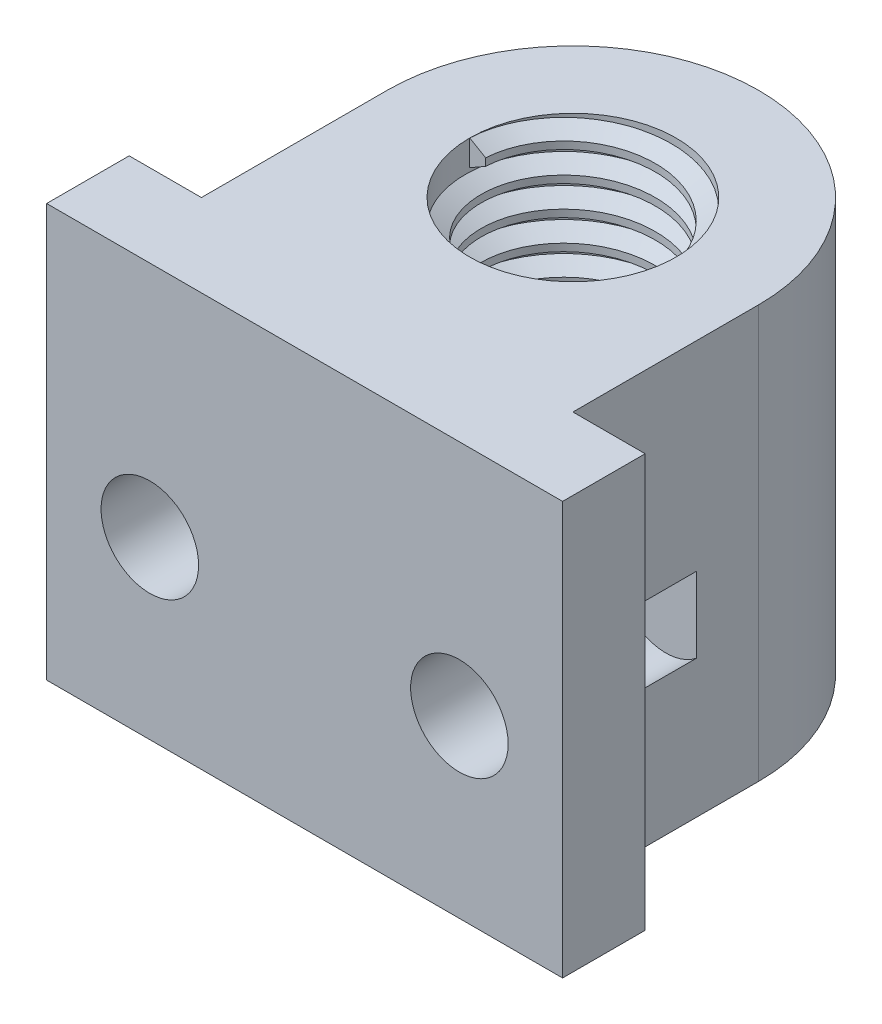
from build123d import *

# Parameters (mm, degrees)
SKETCH1_R           = 5.715
SKETCH1_R_2         = 3.175
SKETCH1_W           = 15.875
SKETCH1_H           = 2.54
BOSS_EXTRUDE1_DEPTH = 12.7
THREAD1_PITCH       = 0.907142857
THREAD1_TO          = 12.7
SKETCH3_R           = 1.5
CUT_EXTRUDE1_DEPTH  = 6.35


with BuildPart() as part:
    # Sketch1 → Boss-Extrude1 (new body)
    # profile 1 of 4: a face of its own
    with BuildSketch(Plane(origin=(0, 0, 0), x_dir=(1, 0, 0), z_dir=(0, 1, 0))):
        Circle(SKETCH1_R)
        with Locations(Location((0, 0, 0), (0, 0, 270))):
            Circle(SKETCH1_R_2, mode=Mode.SUBTRACT)
    # profile 2 of 4: a face of its own
    with BuildSketch(Plane(origin=(0, 0, 0), x_dir=(1, 0, 0), z_dir=(0, 1, 0))):
        with BuildLine():
            Line((-5.715, 0), (-5.715, -5.715))
            Line((-5.715, -5.715), (0, -5.715))
            ThreePointArc((0, -5.715), (-4.041115254, -4.041115254), (-5.715, 0))
        make_face()
    # profile 3 of 4: a face of its own
    with BuildSketch(Plane(origin=(0, 0, 0), x_dir=(1, 0, 0), z_dir=(0, 1, 0))):
        with BuildLine():
            ThreePointArc((5.715, 0), (4.041115254, -4.041115254), (0, -5.715))
            Line((0, -5.715), (5.715, -5.715))
            Line((5.715, -5.715), (5.715, 0))
        make_face()
    # profile 4 of 4: a face of its own
    with BuildSketch(Plane(origin=(0, 0, 0), x_dir=(1, 0, 0), z_dir=(0, 1, 0))):
        with Locations((0, -6.985)):
            Rectangle(SKETCH1_W, SKETCH1_H)
    extrude(amount=BOSS_EXTRUDE1_DEPTH)

    # Thread1: arcs per turn and ends read off the stored shape
    # Thread1: the profile of Thread Profile1 profile screwed along a right-hand helix through 14 turns, 8 arcs to a turn; built about Z, then put on its axis
    thread1_z = Axis((0, 0, 0), (0, 0, 1))
    thread1_corners = [(3.1753, 0, -0.000173205), (3.1753, 0, 0.793923203), (2.683994528, 0, 0.510267856), (2.683994528, 0, 0.283482142)]
    with BuildLine(mode=Mode.PRIVATE) as thread1_profile:
        Line(thread1_corners[0], thread1_corners[1])
        Line(thread1_corners[1], thread1_corners[2])
        Line(thread1_corners[2], thread1_corners[3])
        Line(thread1_corners[3], thread1_corners[0])
    thread1_cap = Face(thread1_profile.wire())
    thread1_turn_angles = [0, 22.5, 45, 67.5, 90, 112.5, 135, 157.5, 180, 202.5, 225, 247.5, 270, 292.5, 315, 337.5, 360]
    thread1_turn_weights = [1, 0.9238795325112867, 1, 0.9238795325112867, 1, 0.9238795325112867, 1, 0.9238795325112867, 1, 0.9238795325112867, 1, 0.9238795325112867, 1, 0.9238795325112867, 1, 0.9238795325112867, 1]
    thread1_turn_rails = [Edge.make_bspline([Vector(p[0], p[1], 0).rotate(thread1_z, thread1_turn_angles[k]) / thread1_turn_weights[k] + Vector(0, 0, p[2] + THREAD1_PITCH * thread1_turn_angles[k] / 360) for k in range(17)], [0, 0, 0, 1, 1, 2, 2, 3, 3, 4, 4, 5, 5, 6, 6, 7, 7, 8, 8, 8], 2, thread1_turn_weights) for p in thread1_corners]
    thread1_turn_sides = [Face.make_surface_from_curves(thread1_turn_rails[p[0]], thread1_turn_rails[p[1]]) for p in [(0, 1), (1, 2), (2, 3), (3, 0)]]
    thread1 = Plane(origin=(0, 12.7, 0), x_dir=(-1, 0, 0), z_dir=(0, -1, 0)) * split(Solid(Shell([*[p.moved(Location((0, 0, THREAD1_PITCH * i))) for i in range(14) for p in thread1_turn_sides], thread1_cap, thread1_cap.rotate(thread1_z, 5040).moved(Location((0, 0, THREAD1_PITCH * 5040 / 360)))])), bisect_by=Plane.XY.offset(THREAD1_TO), keep=Keep.BOTTOM, mode=Mode.PRIVATE)
    add(thread1)

    # Sketch3 → Cut-Extrude1 (cut)
    with BuildSketch(Plane.XY.offset(8.255)):
        with Locations((-4.7625, 5.3975)):
            Circle(SKETCH3_R)
        with Locations((4.7625, 5.3975)):
            Circle(SKETCH3_R)
    extrude(amount=-CUT_EXTRUDE1_DEPTH, mode=Mode.SUBTRACT)


solid = part.part
